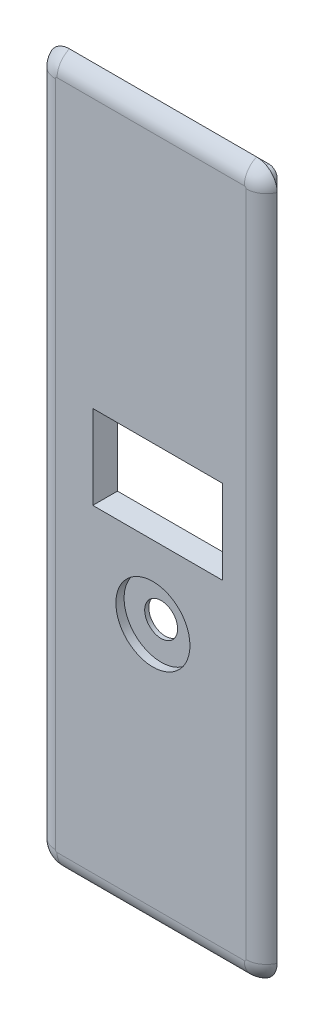
from build123d import *

# Parameters (mm, degrees)
ESQUISSE1_W             = 43.48
ESQUISSE1_H             = 160.19
BOSS_EXTRU_1_DEPTH      = 3
ESQUISSE2_R             = 4
BOSS_EXTRU_2_DEPTH      = 3
ENL_V_MAT_EXTRU_1_REACH = 104.065
ESQUISSE3_W             = 25.5
ESQUISSE3_H             = 14.4
CHANFREIN1_SIZE         = 3
CONG_1_R                = 5
ESQUISSE4_R             = 9
ENL_V_MAT_EXTRU_2_DEPTH = 2


# Some blends are built 0.0001 mm under size
with BuildPart() as part:
    # Esquisse1 → Boss.-Extru.1 (new body)
    with BuildSketch(Plane.XY):
        with BuildLine():
            Line((24.74, -69.15), (24.74, 93.04))
            ThreePointArc((24.74, 93.04), (24.154213562, 94.454213562), (22.74, 95.04))
            Line((22.74, 95.04), (-22.74, 95.04))
            ThreePointArc((-22.74, 95.04), (-24.154213562, 94.454213562), (-24.74, 93.04))
            Line((-24.74, 93.04), (-24.74, -69.15))
            ThreePointArc((-24.74, -69.15), (-24.154213562, -70.564213562), (-22.74, -71.15))
            Line((-22.74, -71.15), (22.74, -71.15))
            ThreePointArc((22.74, -71.15), (24.154213562, -70.564213562), (24.74, -69.15))
        make_face()
        with Locations((0, 11.945)):
            Rectangle(ESQUISSE1_W, ESQUISSE1_H, mode=Mode.SUBTRACT)
    extrude(amount=-BOSS_EXTRU_1_DEPTH)

    # Esquisse2 → Boss.-Extru.2 (add)
    with BuildSketch(Plane.XY):
        with BuildLine():
            Line((-22.74, -74.15), (22.74, -74.15))
            ThreePointArc((22.74, -74.15), (26.275533906, -72.685533906), (27.74, -69.15))
            Line((27.74, -69.15), (27.74, 93.04))
            ThreePointArc((27.74, 93.04), (26.275533906, 96.575533906), (22.74, 98.04))
            Line((22.74, 98.04), (-22.74, 98.04))
            ThreePointArc((-22.74, 98.04), (-26.275533906, 96.575533906), (-27.74, 93.04))
            Line((-27.74, 93.04), (-27.74, -69.15))
            ThreePointArc((-27.74, -69.15), (-26.275533906, -72.685533906), (-22.74, -74.15))
        make_face()
        with Locations((0.548, -9.9)):
            Circle(ESQUISSE2_R, mode=Mode.SUBTRACT)
    extrude(amount=BOSS_EXTRU_2_DEPTH)

    # Esquisse3 → Enlèv. mat.-Extru.1 (cut, up to next)
    with BuildSketch(Plane.XY.offset(3), mode=Mode.PRIVATE) as enl_v_mat_extru_1_sk1:
        with Locations((1.690390628, 18.008987034)):
            Rectangle(ESQUISSE3_W, ESQUISSE3_H)
    enl_v_mat_extru_1_tool1 = extrude(enl_v_mat_extru_1_sk1.sketch, amount=-ENL_V_MAT_EXTRU_1_REACH, mode=Mode.PRIVATE) & part.part
    add(enl_v_mat_extru_1_tool1.solids().sort_by_distance((1.690391, 18.008987, 3))[0], mode=Mode.SUBTRACT)

    # Chanfrein1
    chanfrein1_edges = [part.edges().sort_by_distance(p)[0] for p in [
        (14.440390628, 18.008987034, 3),
        (1.690390628, 10.808987034, 3),
        (-11.059609372, 18.008987034, 3),
        (1.690390628, 25.208987034, 3),
    ]]
    chamfer(chanfrein1_edges, length=CHANFREIN1_SIZE - 0.0001)  # a hair under: the kernel refuses the full size

    # Congé1
    # the kernel refuses this fillet: 5 mm, written as the material it takes off along each edge
    with BuildSketch(Plane(origin=(-27.74, 93.04, 3), x_dir=(1, 0, 0), z_dir=(0, -1, 0)), Plane(origin=(27.74, -69.15, 3), x_dir=(-1, 0, 0), z_dir=(0, 1, 0))) as cong_1_piece_1:
        with BuildLine():
            CenterArc((4.582575695, -5), CONG_1_R, 90, 66.421821522)
            Line((0, -3), (-0.091651514, -2.96))
            ThreePointArc((-0.091651514, -2.96), (-0.1, -1.5), (-0.1, 0))
            Line((-0.1, 0), (0, 0.1))
            Line((0, 0.1), (4.582575695, 0.1))
            Line((4.582575695, 0.1), (4.582575695, 0))
        make_face()
    extrude(amount=162.19, mode=Mode.SUBTRACT)
    with BuildSketch(Plane(origin=(-22.74, 93.04, 3), x_dir=(0, 1, 0), z_dir=(1, 0, 0))) as cong_1_piece_2:
        with BuildLine():
            CenterArc((0.417424305, -5), CONG_1_R, 23.578178478, 66.421821522)
            Line((5, -3), (5.091651514, -2.96))
            ThreePointArc((5.091651514, -2.96), (5.1, -1.5), (5.1, 0))
            Line((5.1, 0), (5, 0.1))
            Line((5, 0.1), (0.417424305, 0.1))
            Line((0.417424305, 0.1), (0.417424305, 0))
        make_face()
    revolve(axis=Axis((-22.74, 93.04, 3), (0, 0, 1)), revolution_arc=90, mode=Mode.SUBTRACT)
    with BuildSketch(Plane(origin=(22.74, 98.04, 3), x_dir=(0, -1, 0), z_dir=(-1, 0, 0)), Plane(origin=(-22.74, -74.15, 3), x_dir=(0, 1, 0), z_dir=(1, 0, 0))) as cong_1_piece_3:
        with BuildLine():
            CenterArc((4.582575695, -5), CONG_1_R, 90, 66.421821522)
            Line((0, -3), (-0.091651514, -2.96))
            ThreePointArc((-0.091651514, -2.96), (-0.1, -1.5), (-0.1, 0))
            Line((-0.1, 0), (0, 0.1))
            Line((0, 0.1), (4.582575695, 0.1))
            Line((4.582575695, 0.1), (4.582575695, 0))
        make_face()
    extrude(amount=45.48, mode=Mode.SUBTRACT)
    with BuildSketch(Plane(origin=(22.74, 93.04, 3), x_dir=(1, 0, 0), z_dir=(0, -1, 0))) as cong_1_piece_4:
        with BuildLine():
            CenterArc((0.417424305, -5), CONG_1_R, 23.578178478, 66.421821522)
            Line((5, -3), (5.091651514, -2.96))
            ThreePointArc((5.091651514, -2.96), (5.1, -1.5), (5.1, 0))
            Line((5.1, 0), (5, 0.1))
            Line((5, 0.1), (0.417424305, 0.1))
            Line((0.417424305, 0.1), (0.417424305, 0))
        make_face()
    revolve(axis=Axis((22.74, 93.04, 3), (0, 0, 1)), revolution_arc=90, mode=Mode.SUBTRACT)
    with BuildSketch(Plane(origin=(22.74, -69.15, 3), x_dir=(0, -1, 0), z_dir=(-1, 0, 0))) as cong_1_piece_5:
        with BuildLine():
            CenterArc((0.417424305, -5), CONG_1_R, 23.578178478, 66.421821522)
            Line((5, -3), (5.091651514, -2.96))
            ThreePointArc((5.091651514, -2.96), (5.1, -1.5), (5.1, 0))
            Line((5.1, 0), (5, 0.1))
            Line((5, 0.1), (0.417424305, 0.1))
            Line((0.417424305, 0.1), (0.417424305, 0))
        make_face()
    revolve(axis=Axis((22.74, -69.15, 3), (0, 0, 1)), revolution_arc=90, mode=Mode.SUBTRACT)
    with BuildSketch(Plane(origin=(-22.74, -69.15, 3), x_dir=(-1, 0, 0), z_dir=(0, 1, 0))) as cong_1_piece_6:
        with BuildLine():
            CenterArc((0.417424305, -5), CONG_1_R, 23.578178478, 66.421821522)
            Line((5, -3), (5.091651514, -2.96))
            ThreePointArc((5.091651514, -2.96), (5.1, -1.5), (5.1, 0))
            Line((5.1, 0), (5, 0.1))
            Line((5, 0.1), (0.417424305, 0.1))
            Line((0.417424305, 0.1), (0.417424305, 0))
        make_face()
    revolve(axis=Axis((-22.74, -69.15, 3), (0, 0, 1)), revolution_arc=90, mode=Mode.SUBTRACT)

    # Esquisse4 → Enlèv. mat.-Extru.2 (cut)
    with BuildSketch(Plane.XY.offset(3)):
        with Locations((0.548, -9.9)):
            Circle(ESQUISSE4_R)
    extrude(amount=-ENL_V_MAT_EXTRU_2_DEPTH, mode=Mode.SUBTRACT)


solid = part.part
